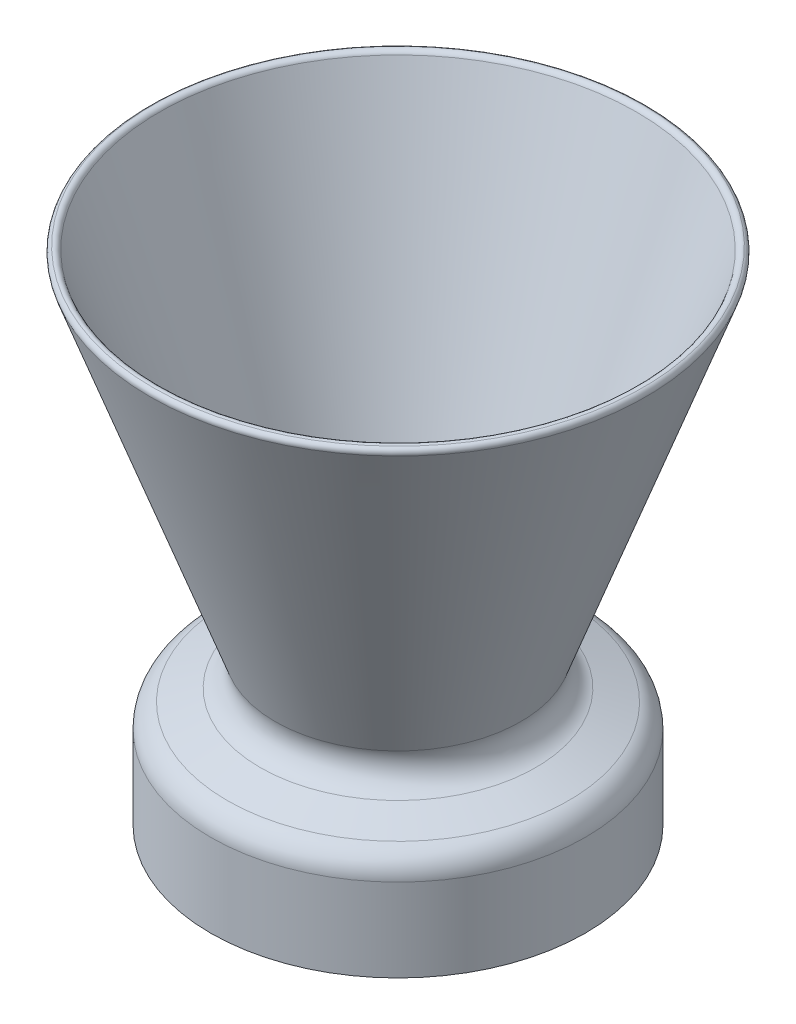
from build123d import *

# Parameters (mm, degrees)
FILLET1_R = 12.7
FILLET2_R = 7.62
FILLET3_R = 2.54


with BuildPart() as part:
    # Sketch1 → Revolve1 (revolve)
    with BuildSketch(Plane.XY, mode=Mode.PRIVATE) as revolve1_sk:
        Polygon((-94.615, 0), (-94.615, 50.8), (-57.648040305, 64.25487298), (-126.077234067, 252.262537672), (-121.303595553, 254), (-38.1, 25.4), (-89.535, 25.4), (-89.535, 0), align=None)
    revolve(revolve1_sk.sketch.rotate(Axis((0, 0, 0), (0, 1, 0)), 270), axis=Axis((0, 0, 0), (0, 1, 0)))

    # Fillet1
    fillet1_edges = [part.edges().sort_by_distance(p)[0] for p in [
        (0, 50.8, 94.615),
        (0, 64.25487298, 57.648040305),
    ]]
    fillet(fillet1_edges, radius=FILLET1_R)

    # Fillet2
    fillet2_edges = [part.edges().sort_by_distance(p)[0] for p in [
        (0, 25.4, 38.1),
    ]]
    fillet(fillet2_edges, radius=FILLET2_R)

    # Fillet3
    fillet3_edges = [part.edges().sort_by_distance(p)[0] for p in [
        (0, 252.262537672, 126.077234067),
        (0, 254, 121.303595553),
    ]]
    fillet(fillet3_edges, radius=FILLET3_R - 0.0001)  # a hair under: the kernel refuses the full size


solid = part.part
